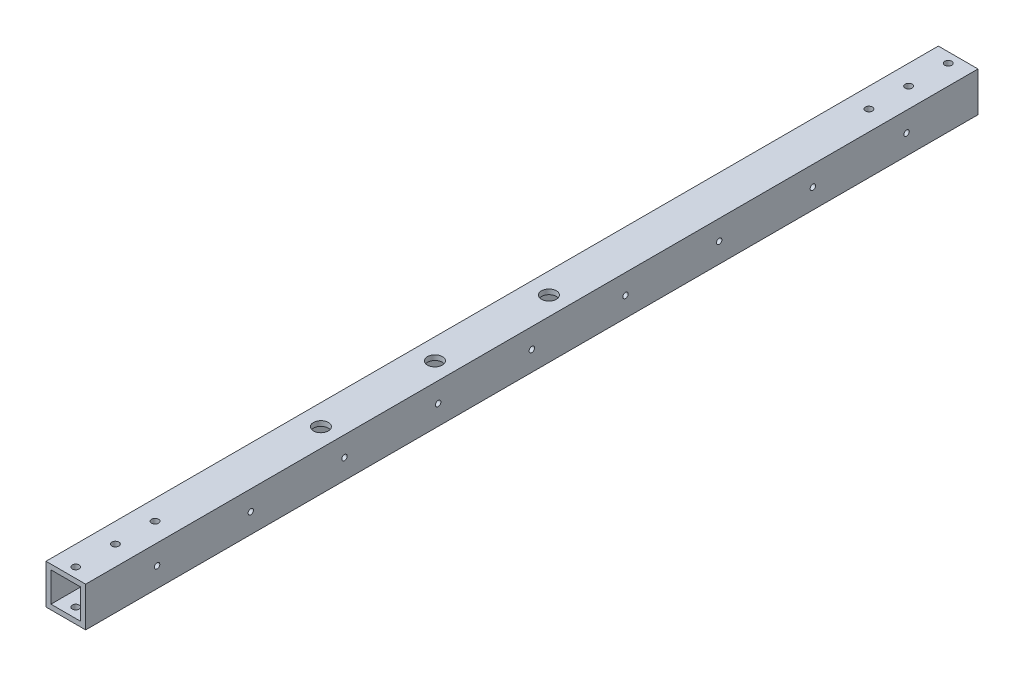
from build123d import *

# Parameters (mm, degrees)
SKETCH1_W                    = 25.4
SKETCH1_H                    = 25.4
SKETCH1_W_2                  = 19.05
SKETCH1_H_2                  = 19.05
EXTRUDE_THIN1_DEPTH          = 571.5
F_8_CLEARANCE_HOLE1_D        = 4.4958
F_8_32_TAPPED_HOLE1_D        = 3.4544
F_8_32_TAPPED_HOLE1_DEPTH    = 10.70864
F_8_32_TAPPED_HOLE1_TIP      = 1.037806461
F_3_8_0_375_DIAMETER_HOLE2_D = 9.525


with BuildPart() as part:
    # Sketch1 → Extrude-Thin1 (new body)
    with BuildSketch(Plane.XY):
        Rectangle(SKETCH1_W, SKETCH1_H)
        Rectangle(SKETCH1_W_2, SKETCH1_H_2, mode=Mode.SUBTRACT)
    extrude(amount=EXTRUDE_THIN1_DEPTH)

    # #8 Clearance Hole1 (through all)
    with Locations(Plane(origin=(0, 12.7, 565.15), x_dir=(0, 0, 1), z_dir=(0, 1, 0))):
        with Locations((0, 0), (-558.8, 0), (-533.4, 0), (-508, 0), (-25.4, 0), (-50.8, 0)):
            Hole(F_8_CLEARANCE_HOLE1_D / 2)

    # #8-32 Tapped Hole1
    with Locations(Plane(origin=(12.7, 82.55, 285.75), x_dir=(0, 0, 1), z_dir=(1, 0, 0))):
        with Locations((-300, 82.55), (-240, 82.55), (-180, 82.55), (-60, 82.55), (0, 82.55), (60, 82.55), (120, 82.55), (180, 82.55), (240, 82.55), (-120, 82.55), (-360, 82.55), (300, 82.55), (360, 82.55)):
            Hole(F_8_32_TAPPED_HOLE1_D / 2, depth=F_8_32_TAPPED_HOLE1_DEPTH)
            with Locations((0, 0, -(F_8_32_TAPPED_HOLE1_DEPTH + F_8_32_TAPPED_HOLE1_TIP / 2))):  # 118° drill point
                Cone(0, F_8_32_TAPPED_HOLE1_D / 2, F_8_32_TAPPED_HOLE1_TIP, mode=Mode.SUBTRACT)

    # 3/8 (0.375) Diameter Hole2 (through all)
    with Locations(Plane(origin=(-346.075, -12.7, 285.75), x_dir=(0, 0, 1), z_dir=(0, -1, 0))):
        with Locations((-92.583, 346.075), (-35.433, 346.075), (35.814, 346.075), (92.964, 346.075), (-22.9616, -346.775), (50.0634, -346.775), (123.0884, -346.775), (-381, 114.3), (-381, 98.425), (-381, 82.55), (-381, -114.3), (-381, -130.175), (-381, -146.05)):
            Hole(F_3_8_0_375_DIAMETER_HOLE2_D / 2)


solid = part.part
